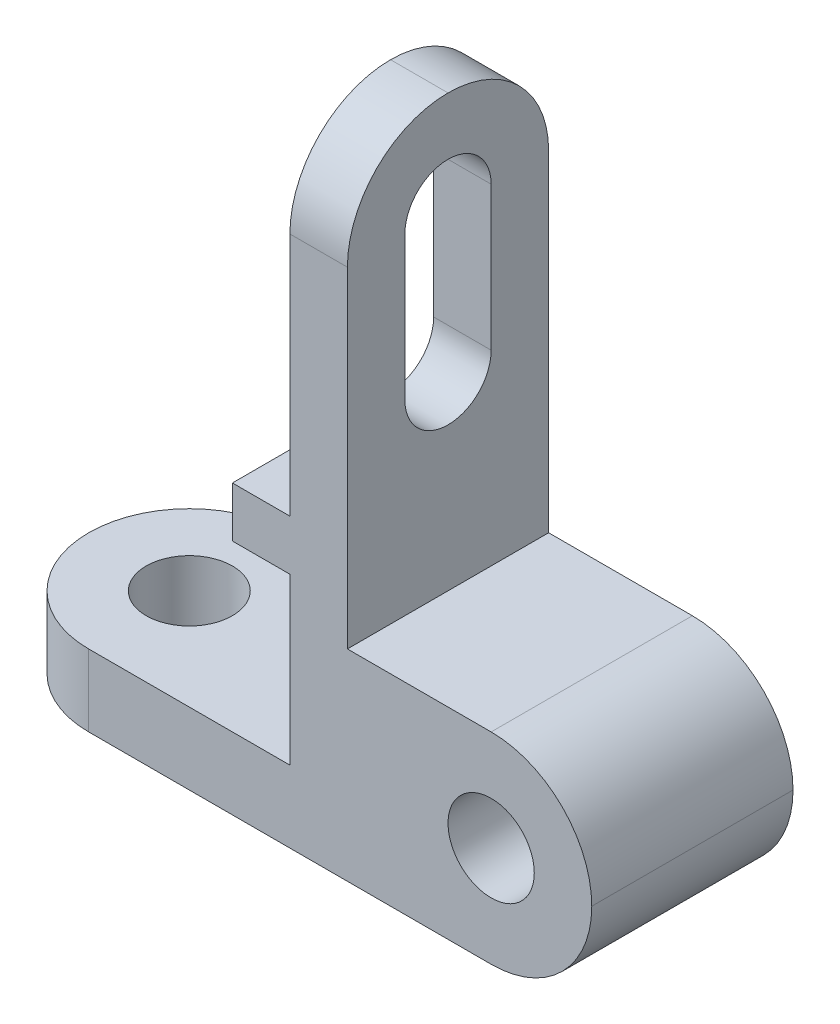
from build123d import *

# Parameters (mm, degrees)
SKETCH2_R           = 6
BOSS_EXTRUDE1_DEPTH = 14
CUT_EXTRUDE1_DEPTH  = 8
SKETCH4_R           = 6
CUT_EXTRUDE2_DEPTH  = 10
FILLET1_R           = 14


with BuildPart() as part:
    # Sketch2 → Boss-Extrude1 (new, symmetric)
    with BuildSketch(Plane.XY):
        Polygon((0, 0), (0, 28), (-34, 28), (-34, 88), (-42, 88), (-42, 40), (-50, 40), (-50, 33), (-42, 33), (-42, 10), (-84, 10), (-84, 0), align=None)
        with Locations((-14, 14)):
            Circle(SKETCH2_R, mode=Mode.SUBTRACT)
    extrude(amount=BOSS_EXTRUDE1_DEPTH, both=True)

    # Sketch3 → Cut-Extrude1 (cut)
    with BuildSketch(Plane(origin=(-34, 0, 0), x_dir=(0, 0, -1), z_dir=(1, 0, 0))):
        with BuildLine():
            Line((-6, 54), (-6, 74))
            ThreePointArc((-6, 74), (0, 80), (6, 74))
            Line((6, 74), (6, 54))
            ThreePointArc((6, 54), (0, 48), (-6, 54))
        make_face()
    extrude(amount=-CUT_EXTRUDE1_DEPTH, mode=Mode.SUBTRACT)

    # Sketch4 → Cut-Extrude2 (cut)
    with BuildSketch(Plane(origin=(0, 10, 0), x_dir=(1, 0, 0), z_dir=(0, 1, 0))):
        with Locations(Location((-70, 0, 0), (0, 0, 180))):
            Circle(SKETCH4_R)
    extrude(amount=-CUT_EXTRUDE2_DEPTH, mode=Mode.SUBTRACT)

    # Fillet1
    fillet1_edges = [part.edges().sort_by_distance(p)[0] for p in [
        (-84, 5, -14),
        (-84, 5, 14),
        (-38, 88, -14),
        (-38, 88, 14),
        (0, 0, 0),
        (0, 28, 0),
    ]]
    fillet(fillet1_edges, radius=FILLET1_R - 0.0001)  # a hair under: the kernel refuses the full size


solid = part.part
